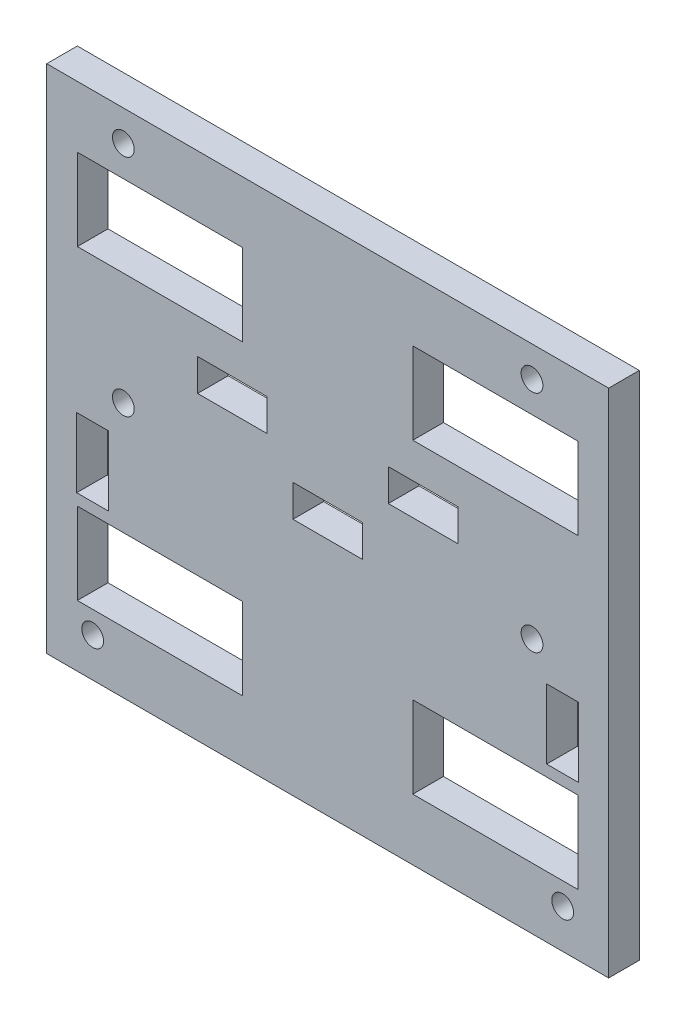
from build123d import *

# Parameters (mm, degrees)
SKETCH1_W           = 82.5
SKETCH1_H           = 75
SKETCH1_W_2         = 24.25
SKETCH1_H_2         = 12
BOSS_EXTRUDE1_DEPTH = 4.5
SKETCH2_R           = 1.6
SCREWHOLES_DEPTH    = 56.929084563
SKETCH3_W           = 10.2
SKETCH3_H           = 4.7
BELTCLAMP_DEPTH     = 56.929084563
SKETCH4_W           = 10.2
SKETCH4_H           = 4.7
CUT_EXTRUDE3_DEPTH  = 56.929084563
SKETCH5_R           = 1.6
SKETCH5_W           = 4.7
SKETCH5_H           = 10.2
CUT_EXTRUDE4_DEPTH  = 56.929084563


with BuildPart() as part:
    # Sketch1 → Boss-Extrude1 (new body)
    with BuildSketch(Plane.XY):
        Rectangle(SKETCH1_W, SKETCH1_H)
        with Locations((-24.625, 22.5)):
            Rectangle(SKETCH1_W_2, SKETCH1_H_2, mode=Mode.SUBTRACT)
        with Locations((24.625, 22.5)):
            Rectangle(SKETCH1_W_2, SKETCH1_H_2, mode=Mode.SUBTRACT)
        with Locations((24.625, -22.5)):
            Rectangle(SKETCH1_W_2, SKETCH1_H_2, mode=Mode.SUBTRACT)
        with Locations((-24.625, -22.5)):
            Rectangle(SKETCH1_W_2, SKETCH1_H_2, mode=Mode.SUBTRACT)
    extrude(amount=BOSS_EXTRUDE1_DEPTH)

    # Sketch2 → screwHoles (cut, through all)
    with BuildSketch(Plane.XY.offset(4.5)):
        with Locations((-30, 33)):
            Circle(SKETCH2_R)
        with Locations((30, 33)):
            Circle(SKETCH2_R)
        with Locations((30, 0)):
            Circle(SKETCH2_R)
        with Locations((-30, 0)):
            Circle(SKETCH2_R)
    extrude(amount=-SCREWHOLES_DEPTH, mode=Mode.SUBTRACT)

    # Sketch3 → BeltClamp (cut, through all)
    with BuildSketch(Plane.XY.offset(4.5)):
        with Locations((-14, 9)):
            Rectangle(SKETCH3_W, SKETCH3_H)
        with Locations((14, 9)):
            Rectangle(SKETCH3_W, SKETCH3_H)
    extrude(amount=-BELTCLAMP_DEPTH, mode=Mode.SUBTRACT)

    # Sketch4 → Cut-Extrude3 (cut, through all)
    with BuildSketch(Plane.XY.offset(4.5)):
        Rectangle(SKETCH4_W, SKETCH4_H)
    extrude(amount=-CUT_EXTRUDE3_DEPTH, mode=Mode.SUBTRACT)

    # Sketch5 → Cut-Extrude4 (cut, through all)
    with BuildSketch(Plane.XY.offset(4.5)):
        with Locations((34.5, -31.75)):
            Circle(SKETCH5_R)
        with Locations((-34.5, -31.75)):
            Circle(SKETCH5_R)
        with Locations((34.5, -9.75)):
            Rectangle(SKETCH5_W, SKETCH5_H)
        with Locations((-34.5, -9.75)):
            Rectangle(SKETCH5_W, SKETCH5_H)
    extrude(amount=-CUT_EXTRUDE4_DEPTH, mode=Mode.SUBTRACT)


solid = part.part
